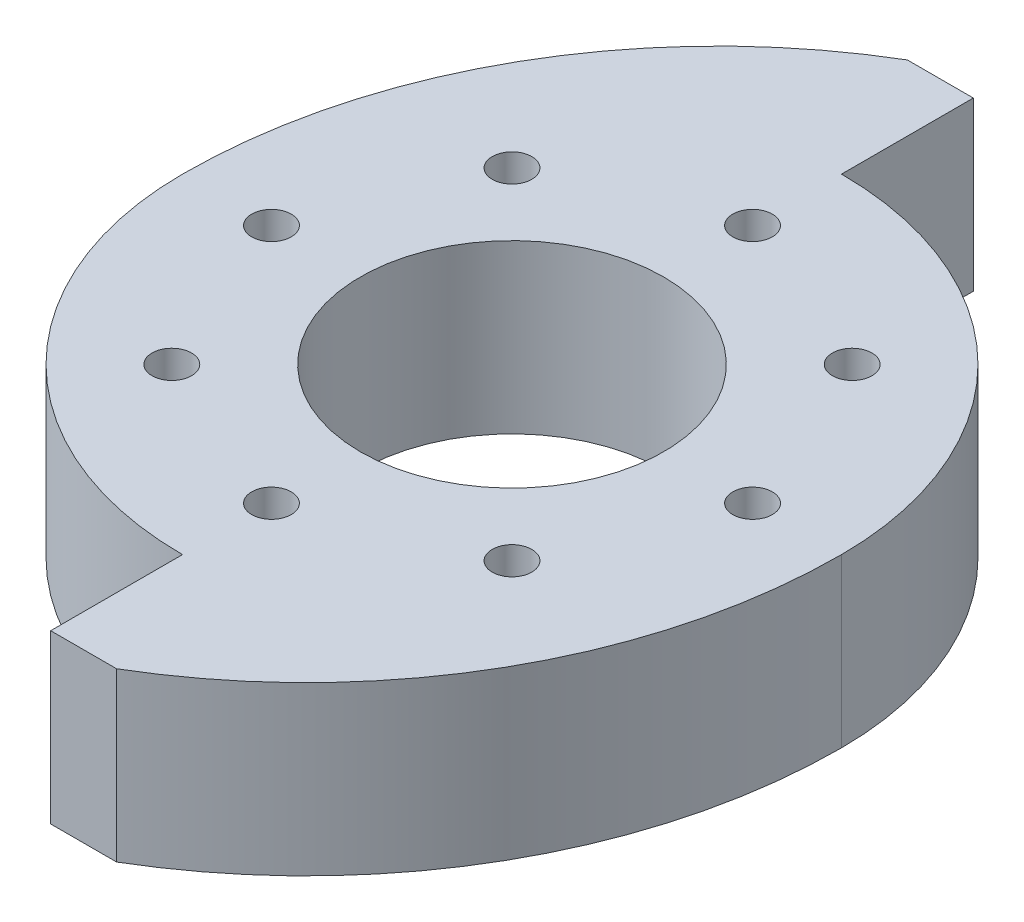
from build123d import *

# Parameters (mm, degrees)
SKETCH1_R           = 1.5
SKETCH1_R_2         = 11.5
BOSS_EXTRUDE1_DEPTH = 6.35


with BuildPart() as part:
    # Sketch1 → Boss-Extrude1 (new, symmetric)
    with BuildSketch(Plane(origin=(0, 0, 0), x_dir=(1, 0, 0), z_dir=(0, 1, 0))):
        with BuildLine():
            ThreePointArc((-5, 35), (-19.647377649, 20.155644371), (-25, 0))
            ThreePointArc((-25, 0), (-17.67766953, -17.67766953), (0, -25))
            Line((0, -25), (0, -35))
            Line((0, -35), (5, -35))
            ThreePointArc((5, -35), (19.647377649, -20.155644371), (25, 0))
            ThreePointArc((25, 0), (17.67766953, 17.67766953), (0, 25))
            Line((0, 25), (0, 35))
            Line((0, 35), (-5, 35))
        make_face()
        with Locations((0, 18.25)):
            Circle(SKETCH1_R, mode=Mode.SUBTRACT)
        with Locations((-12.904698757, -12.904698757)):
            Circle(SKETCH1_R, mode=Mode.SUBTRACT)
        with Locations((0, -18.25)):
            Circle(SKETCH1_R, mode=Mode.SUBTRACT)
        with Locations((12.904698757, -12.904698757)):
            Circle(SKETCH1_R, mode=Mode.SUBTRACT)
        with Locations((-18.25, 0)):
            Circle(SKETCH1_R, mode=Mode.SUBTRACT)
        with Locations((-12.904698757, 12.904698757)):
            Circle(SKETCH1_R, mode=Mode.SUBTRACT)
        Circle(SKETCH1_R_2, mode=Mode.SUBTRACT)
        with Locations((18.25, 0)):
            Circle(SKETCH1_R, mode=Mode.SUBTRACT)
        with Locations((12.904698757, 12.904698757)):
            Circle(SKETCH1_R, mode=Mode.SUBTRACT)
    extrude(amount=BOSS_EXTRUDE1_DEPTH, both=True)


solid = part.part
